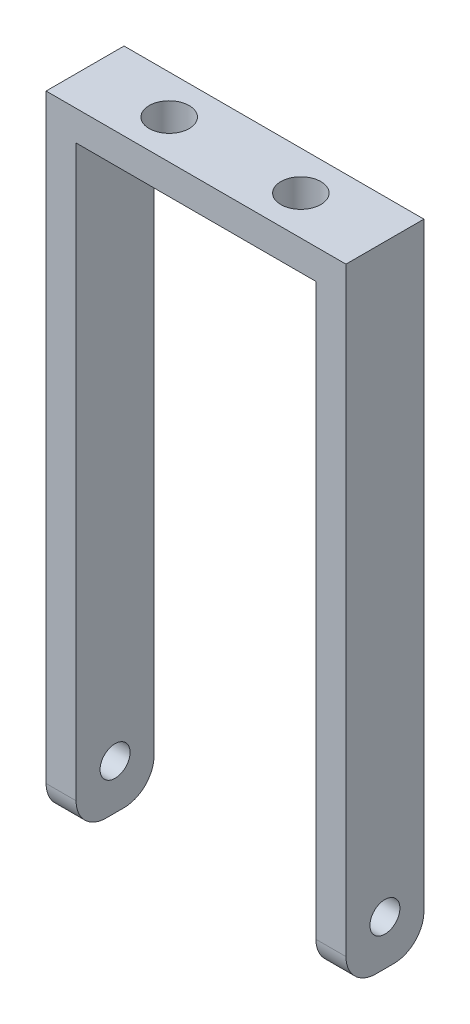
from build123d import *

# Parameters (mm, degrees)
SKETCH1_W               = 30
SKETCH1_H               = 7.8
BOSS_EXTRUDE1_DEPTH     = 3
CUT_EXTRUDE1_REACH      = 17.786
SKETCH2_R               = 2
SKETCH3_W               = 3
SKETCH3_H               = 7.8
BOSS_EXTRUDE2_DEPTH     = 60
CUT_EXTRUDE2_DEPTH      = 70.887123277
CUT_EXTRUDE2_DEPTH_BACK = 70.887123277
SKETCH4_R               = 1.5
FILLET1_R               = 3


with BuildPart() as part:
    # Sketch1 → Boss-Extrude1 (new body)
    with BuildSketch(Plane(origin=(0, 0, 0), x_dir=(1, 0, 0), z_dir=(0, 1, 0))):
        Rectangle(SKETCH1_W, SKETCH1_H)
    extrude(amount=-BOSS_EXTRUDE1_DEPTH)

    # Sketch2 → Cut-Extrude1 (cut, up to next)
    with BuildSketch(Plane(origin=(0, 0, 0), x_dir=(1, 0, 0), z_dir=(0, 1, 0)), mode=Mode.PRIVATE) as cut_extrude1_sk1:
        with Locations((-6.585, 0)):
            Circle(SKETCH2_R)
    cut_extrude1_tool1 = extrude(cut_extrude1_sk1.sketch, amount=-CUT_EXTRUDE1_REACH, mode=Mode.PRIVATE) & part.part
    # Sketch2 → Cut-Extrude1 (cut, up to next)
    with BuildSketch(Plane(origin=(0, 0, 0), x_dir=(1, 0, 0), z_dir=(0, 1, 0)), mode=Mode.PRIVATE) as cut_extrude1_sk2:
        with Locations((6.585, 0)):
            Circle(SKETCH2_R)
    cut_extrude1_tool2 = extrude(cut_extrude1_sk2.sketch, amount=-CUT_EXTRUDE1_REACH, mode=Mode.PRIVATE) & part.part
    add(cut_extrude1_tool1.solids().sort_by_distance((-6.585, 0, 0))[0], mode=Mode.SUBTRACT)
    add(cut_extrude1_tool2.solids().sort_by_distance((6.585, 0, 0))[0], mode=Mode.SUBTRACT)

    # Sketch3 → Boss-Extrude2 (add)
    with BuildSketch(Plane.XZ.offset(3)):
        with Locations((-13.5, 0)):
            Rectangle(SKETCH3_W, SKETCH3_H)
        with Locations((13.5, 0)):
            Rectangle(SKETCH3_W, SKETCH3_H)
    extrude(amount=BOSS_EXTRUDE2_DEPTH)

    # Sketch4 → Cut-Extrude2 (cut, two sides: drawn at the far end of the back side and taken through both)
    with BuildSketch(Plane(origin=(15, 0, 0), x_dir=(0, 0, -1), z_dir=(1, 0, 0)).offset(-CUT_EXTRUDE2_DEPTH_BACK)):
        with Locations((0, -58.5)):
            Circle(SKETCH4_R)
    extrude(amount=CUT_EXTRUDE2_DEPTH + CUT_EXTRUDE2_DEPTH_BACK, mode=Mode.SUBTRACT)

    # Fillet1
    fillet1_edges = [part.edges().sort_by_distance(p)[0] for p in [
        (-13.5, -63, -3.9),
        (13.5, -63, -3.9),
        (-13.5, -63, 3.9),
        (13.5, -63, 3.9),
    ]]
    fillet(fillet1_edges, radius=FILLET1_R)


solid = part.part
